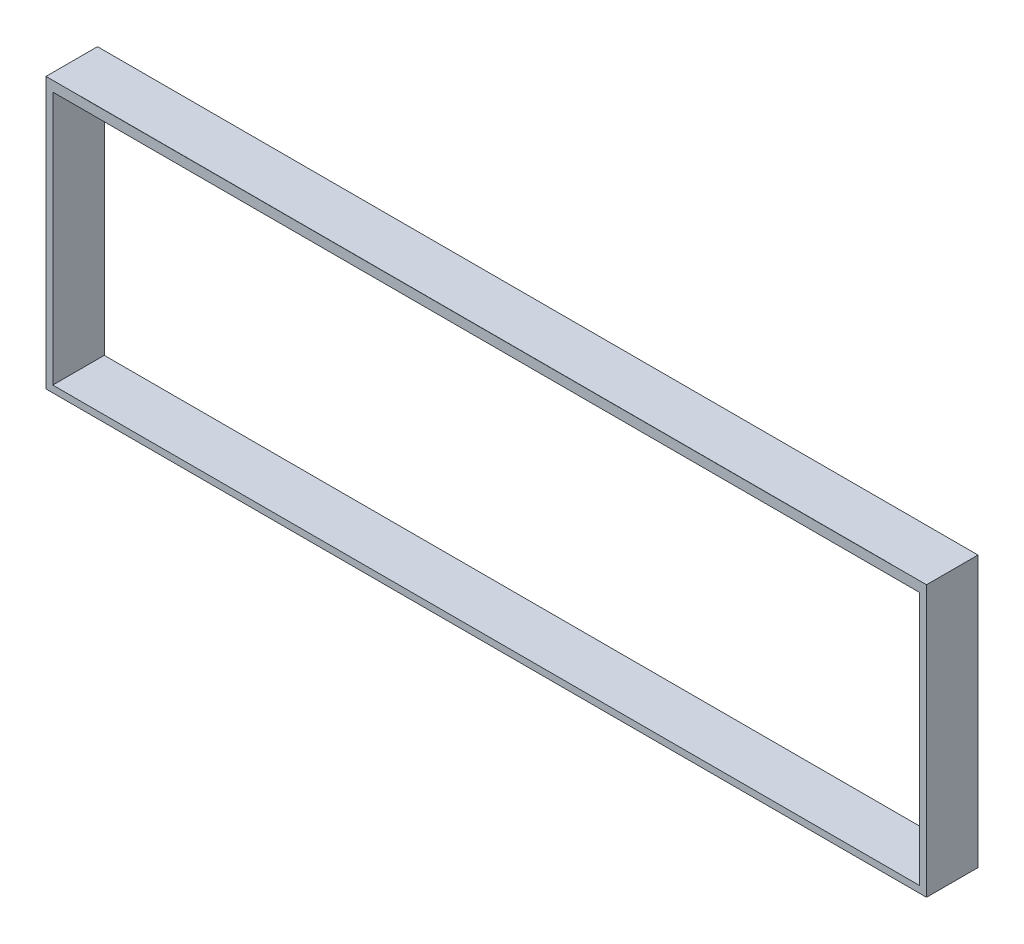
from build123d import *

# Parameters (mm, degrees)
BOSS_EXTRUDE1_DEPTH                 = 130.100001
BOSS_EXTRUDE1_DEPTH_BACK            = 130.100001
SHELL1_START                        = 85.7839
SHELL1_OUTLINE_W                    = 256.200002558
SHELL1_OUTLINE_H                    = 75
SHELL1_DEPTH                        = 240.188061984
BACK_CORNER_CHAMS_SIZE              = 3
LATCH_RIB_DEPTH                     = 119.100001
LATCH_RIB_CHAMFER_SIZE              = 2.4
LPATTERN1_COUNT                     = 6
LPATTERN1_PITCH                     = 35
LATCH_RIB_CHAMFER_OF_LPATTERN1_SIZE = 2.4
STACKER_LATCH_SLOT_DEPTH            = 120.100001
STACKER_LATCH_SLOT_CHAMFER_SIZE     = 2.5
SKETCH6_W                           = 311.302660761
SKETCH6_H                           = 137.717887742
CUT_EXTRUDE1_DEPTH                  = 31
SKETCH7_W                           = 311.302660761
SKETCH7_H                           = 137.717887742
CUT_EXTRUDE2_DEPTH                  = 249.457280353


with BuildPart() as part:
    # Sketch1 → Boss-Extrude1 (new, two sides: drawn at the far end of the back side and taken through both)
    with BuildSketch(Plane(origin=(0, 0, 0), x_dir=(0, 0, -1), z_dir=(1, 0, 0)).offset(-BOSS_EXTRUDE1_DEPTH_BACK)):
        Polygon((-83.7839, 0), (-279.783940449, 0), (-325.971961984, 80), (-83.7839, 80), align=None)
    extrude(amount=BOSS_EXTRUDE1_DEPTH + BOSS_EXTRUDE1_DEPTH_BACK)

    # Shell1: read off the stored shape, not the designer's step
    # Shell1 outline → Shell1 (cut)
    with BuildSketch(Plane.XY.offset(SHELL1_START)):
        with Locations((0, 39.5)):
            Rectangle(SHELL1_OUTLINE_W, SHELL1_OUTLINE_H)
    extrude(amount=SHELL1_DEPTH, mode=Mode.SUBTRACT)

    # Back Corner Chams
    back_corner_chams_edges = [part.edges().sort_by_distance(p)[0] for p in [
        (-130.100001, 40, 83.7839),
        (130.100001, 40, 83.7839),
    ]]
    chamfer(back_corner_chams_edges, length=BACK_CORNER_CHAMS_SIZE)

    # Sketch2 → Latch Rib (add, symmetric)
    with BuildSketch(Plane(origin=(0, 0, 0), x_dir=(0, 0, -1), z_dir=(1, 0, 0))):
        Polygon((-258.783940449, 0), (-260.227316122, -2.5), (-262.915246901, -2.5), (-269.783940449, 0), align=None)
    latch_rib = extrude(amount=LATCH_RIB_DEPTH, both=True)

    # Latch Rib Chamfer
    latch_rib_chamfer_edges = [part.edges().sort_by_distance(p)[0] for p in [
        (119.100001, -2.5, 261.571281511),
        (-119.100001, -2.5, 261.571281511),
    ]]
    chamfer(latch_rib_chamfer_edges, length=LATCH_RIB_CHAMFER_SIZE)

    # LPattern1: Latch Rib ×6
    with Locations(*[(0, 0, -i * LPATTERN1_PITCH) for i in range(1, LPATTERN1_COUNT)]):
        add(latch_rib)

    # Latch Rib Chamfer of LPattern1
    latch_rib_chamfer_of_lpattern1_edges = [part.edges().sort_by_distance(p)[0] for p in [
        (119.100001, -2.5, 226.571281511),
        (-119.100001, -2.5, 226.571281511),
        (119.100001, -2.5, 191.571281511),
        (-119.100001, -2.5, 191.571281511),
        (119.100001, -2.5, 156.571281511),
        (-119.100001, -2.5, 156.571281511),
        (119.100001, -2.5, 121.571281511),
        (-119.100001, -2.5, 121.571281511),
        (119.100001, -2.5, 86.571281511),
        (-119.100001, -2.5, 86.571281511),
    ]]
    chamfer(latch_rib_chamfer_of_lpattern1_edges, length=LATCH_RIB_CHAMFER_OF_LPATTERN1_SIZE)

    # Sketch3 → Stacker Latch Slot (cut, symmetric)
    with BuildSketch(Plane(origin=(0, 0, 0), x_dir=(0, 0, -1), z_dir=(1, 0, 0))):
        Polygon((-315.971961984, 80), (-304.971961984, 80), (-307.371961984, 77.6), (-309.378016178, 77.6), align=None)
    extrude(amount=STACKER_LATCH_SLOT_DEPTH, both=True, mode=Mode.SUBTRACT)

    # Stacker Latch Slot Chamfer
    # the kernel refuses this chamfer: 2.5 mm, written as the material it adds along each edge
    with BuildSketch(Plane(origin=(120.100001, 77.6, 300.942754515), x_dir=(0, 1, 0), z_dir=(0, 0, 1))) as stacker_latch_slot_chamfer_piece_1_section:
        Polygon((STACKER_LATCH_SLOT_CHAMFER_SIZE, 0), (0, STACKER_LATCH_SLOT_CHAMFER_SIZE), (0, 0), align=None)
    stacker_latch_slot_chamfer_piece_1 = extrude(amount=19.364914362, mode=Mode.PRIVATE)
    stacker_latch_slot_chamfer_piece_1 = split(stacker_latch_slot_chamfer_piece_1, bisect_by=Plane(origin=(120.100001, 80, 300.942754515), z_dir=(0, -1, 0)), keep=Keep.TOP, mode=Mode.PRIVATE)
    add(stacker_latch_slot_chamfer_piece_1)
    with BuildSketch(Plane(origin=(-120.100001, 77.6, 300.942754515), x_dir=(0, 1, 0), z_dir=(0, 0, 1))) as stacker_latch_slot_chamfer_piece_2_section:
        Polygon((STACKER_LATCH_SLOT_CHAMFER_SIZE, 0), (0, -STACKER_LATCH_SLOT_CHAMFER_SIZE), (0, 0), align=None)
    stacker_latch_slot_chamfer_piece_2 = extrude(amount=19.364914362, mode=Mode.PRIVATE)
    stacker_latch_slot_chamfer_piece_2 = split(stacker_latch_slot_chamfer_piece_2, bisect_by=Plane(origin=(-120.100001, 80, 300.942754515), z_dir=(0, -1, 0)), keep=Keep.TOP, mode=Mode.PRIVATE)
    add(stacker_latch_slot_chamfer_piece_2)

    # LPattern2: read off the stored shape, not the designer's step
    # LPattern2: loft between two sections, ruled curve by curve
    lpattern2_from = [
        Edge.make_line((120.000001279, 80, 105.971961984), (120.000001279, 80, 94.971961984)),
        Edge.make_line((-120.000001279, 80, 94.971961984), (-120.000001279, 80, 105.971961984)),
        Edge.make_line((-120.000001279, 80, 105.971961984), (120.000001279, 80, 105.971961984)),
        Edge.make_line((120.000001279, 80, 94.971961984), (-120.000001279, 80, 94.971961984)),
    ]
    lpattern2_to = [
        Edge.make_line((117.600001279, 77.6, 99.378016178), (117.600001279, 77.6, 97.371961984)),
        Edge.make_line((-117.600001279, 77.6, 97.371961984), (-117.600001279, 77.6, 99.378016178)),
        Edge.make_line((-117.600001279, 77.6, 99.378016178), (117.600001279, 77.6, 99.378016178)),
        Edge.make_line((117.600001279, 77.6, 97.371961984), (-117.600001279, 77.6, 97.371961984)),
    ]
    lpattern2 = Solid(Shell([*[Face.make_surface_from_curves(lpattern2_from[k], lpattern2_to[k]) for k in range(4)], Face(Wire(lpattern2_from)), Face(Wire(lpattern2_to))]))
    add(lpattern2, mode=Mode.SUBTRACT)

    # LPattern2 2: loft between two sections, ruled curve by curve
    lpattern2_2_from = [
        Edge.make_line((120.000001279, 80, 140.971961984), (120.000001279, 80, 129.971961984)),
        Edge.make_line((-120.000001279, 80, 129.971961984), (-120.000001279, 80, 140.971961984)),
        Edge.make_line((-120.000001279, 80, 140.971961984), (120.000001279, 80, 140.971961984)),
        Edge.make_line((120.000001279, 80, 129.971961984), (-120.000001279, 80, 129.971961984)),
    ]
    lpattern2_2_to = [
        Edge.make_line((117.600001279, 77.6, 134.378016178), (117.600001279, 77.6, 132.371961984)),
        Edge.make_line((-117.600001279, 77.6, 132.371961984), (-117.600001279, 77.6, 134.378016178)),
        Edge.make_line((-117.600001279, 77.6, 134.378016178), (117.600001279, 77.6, 134.378016178)),
        Edge.make_line((117.600001279, 77.6, 132.371961984), (-117.600001279, 77.6, 132.371961984)),
    ]
    lpattern2_2 = Solid(Shell([*[Face.make_surface_from_curves(lpattern2_2_from[k], lpattern2_2_to[k]) for k in range(4)], Face(Wire(lpattern2_2_from)), Face(Wire(lpattern2_2_to))]))
    add(lpattern2_2, mode=Mode.SUBTRACT)

    # LPattern2 3: loft between two sections, ruled curve by curve
    lpattern2_3_from = [
        Edge.make_line((120.000001279, 80, 175.971961984), (120.000001279, 80, 164.971961984)),
        Edge.make_line((-120.000001279, 80, 164.971961984), (-120.000001279, 80, 175.971961984)),
        Edge.make_line((-120.000001279, 80, 175.971961984), (120.000001279, 80, 175.971961984)),
        Edge.make_line((120.000001279, 80, 164.971961984), (-120.000001279, 80, 164.971961984)),
    ]
    lpattern2_3_to = [
        Edge.make_line((117.600001279, 77.6, 169.378016178), (117.600001279, 77.6, 167.371961984)),
        Edge.make_line((-117.600001279, 77.6, 167.371961984), (-117.600001279, 77.6, 169.378016178)),
        Edge.make_line((-117.600001279, 77.6, 169.378016178), (117.600001279, 77.6, 169.378016178)),
        Edge.make_line((117.600001279, 77.6, 167.371961984), (-117.600001279, 77.6, 167.371961984)),
    ]
    lpattern2_3 = Solid(Shell([*[Face.make_surface_from_curves(lpattern2_3_from[k], lpattern2_3_to[k]) for k in range(4)], Face(Wire(lpattern2_3_from)), Face(Wire(lpattern2_3_to))]))
    add(lpattern2_3, mode=Mode.SUBTRACT)

    # LPattern2 4: loft between two sections, ruled curve by curve
    lpattern2_4_from = [
        Edge.make_line((120.000001279, 80, 210.971961984), (120.000001279, 80, 199.971961984)),
        Edge.make_line((-120.000001279, 80, 199.971961984), (-120.000001279, 80, 210.971961984)),
        Edge.make_line((-120.000001279, 80, 210.971961984), (120.000001279, 80, 210.971961984)),
        Edge.make_line((120.000001279, 80, 199.971961984), (-120.000001279, 80, 199.971961984)),
    ]
    lpattern2_4_to = [
        Edge.make_line((117.600001279, 77.6, 204.378016178), (117.600001279, 77.6, 202.371961984)),
        Edge.make_line((-117.600001279, 77.6, 202.371961984), (-117.600001279, 77.6, 204.378016178)),
        Edge.make_line((-117.600001279, 77.6, 204.378016178), (117.600001279, 77.6, 204.378016178)),
        Edge.make_line((117.600001279, 77.6, 202.371961984), (-117.600001279, 77.6, 202.371961984)),
    ]
    lpattern2_4 = Solid(Shell([*[Face.make_surface_from_curves(lpattern2_4_from[k], lpattern2_4_to[k]) for k in range(4)], Face(Wire(lpattern2_4_from)), Face(Wire(lpattern2_4_to))]))
    add(lpattern2_4, mode=Mode.SUBTRACT)

    # LPattern2 5: loft between two sections, ruled curve by curve
    lpattern2_5_from = [
        Edge.make_line((120.000001279, 80, 245.971961984), (120.000001279, 80, 234.971961984)),
        Edge.make_line((-120.000001279, 80, 234.971961984), (-120.000001279, 80, 245.971961984)),
        Edge.make_line((-120.000001279, 80, 245.971961984), (120.000001279, 80, 245.971961984)),
        Edge.make_line((120.000001279, 80, 234.971961984), (-120.000001279, 80, 234.971961984)),
    ]
    lpattern2_5_to = [
        Edge.make_line((117.600001279, 77.6, 239.378016178), (117.600001279, 77.6, 237.371961984)),
        Edge.make_line((-117.600001279, 77.6, 237.371961984), (-117.600001279, 77.6, 239.378016178)),
        Edge.make_line((-117.600001279, 77.6, 239.378016178), (117.600001279, 77.6, 239.378016178)),
        Edge.make_line((117.600001279, 77.6, 237.371961984), (-117.600001279, 77.6, 237.371961984)),
    ]
    lpattern2_5 = Solid(Shell([*[Face.make_surface_from_curves(lpattern2_5_from[k], lpattern2_5_to[k]) for k in range(4)], Face(Wire(lpattern2_5_from)), Face(Wire(lpattern2_5_to))]))
    add(lpattern2_5, mode=Mode.SUBTRACT)

    # LPattern2 6: loft between two sections, ruled curve by curve
    lpattern2_6_from = [
        Edge.make_line((120.000001279, 80, 280.971961984), (120.000001279, 80, 269.971961984)),
        Edge.make_line((-120.000001279, 80, 269.971961984), (-120.000001279, 80, 280.971961984)),
        Edge.make_line((-120.000001279, 80, 280.971961984), (120.000001279, 80, 280.971961984)),
        Edge.make_line((120.000001279, 80, 269.971961984), (-120.000001279, 80, 269.971961984)),
    ]
    lpattern2_6_to = [
        Edge.make_line((117.600001279, 77.6, 274.378016178), (117.600001279, 77.6, 272.371961984)),
        Edge.make_line((-117.600001279, 77.6, 272.371961984), (-117.600001279, 77.6, 274.378016178)),
        Edge.make_line((-117.600001279, 77.6, 274.378016178), (117.600001279, 77.6, 274.378016178)),
        Edge.make_line((117.600001279, 77.6, 272.371961984), (-117.600001279, 77.6, 272.371961984)),
    ]
    lpattern2_6 = Solid(Shell([*[Face.make_surface_from_curves(lpattern2_6_from[k], lpattern2_6_to[k]) for k in range(4)], Face(Wire(lpattern2_6_from)), Face(Wire(lpattern2_6_to))]))
    add(lpattern2_6, mode=Mode.SUBTRACT)

    # Sketch6 → Cut-Extrude1 (cut)
    with BuildSketch(Plane(origin=(0, 0, 83.7839), x_dir=(-1, 0, 0), z_dir=(0, 0, -1))):
        with Locations((1.437413341, 38.133965711)):
            Rectangle(SKETCH6_W, SKETCH6_H)
    extrude(amount=-CUT_EXTRUDE1_DEPTH, mode=Mode.SUBTRACT)

    # Sketch7 → Cut-Extrude2 (cut, through all)
    with BuildSketch(Plane.XY.offset(130)):
        with Locations((-1.437413341, 38.133965711)):
            Rectangle(SKETCH7_W, SKETCH7_H)
    extrude(amount=CUT_EXTRUDE2_DEPTH, mode=Mode.SUBTRACT)


solid = part.part
